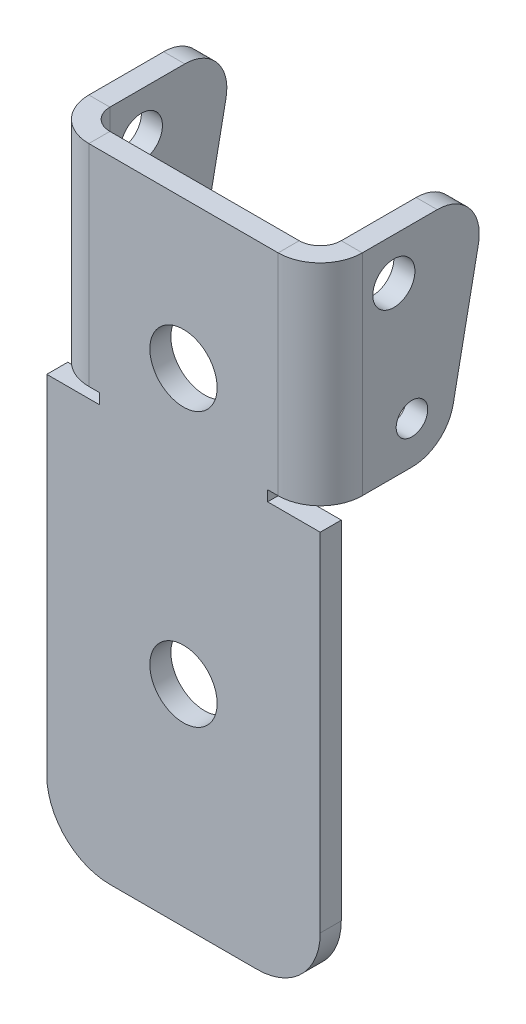
from build123d import *

# Parameters (mm, degrees)
SKETCH_1_W                        = 13
SKETCH_1_H                        = 30
SM_BASE_FLANGE_1_DEPTH            = 1
SM_EDGE_FLANGE_1_STRIP_W          = 6
SM_EDGE_FLANGE_1_STRIP_H          = 1
SM_EDGE_FLANGE_1_STRIP_CUT_DEPTH  = 10
SM_EDGE_FLANGE_1_RELIEF_W         = 6.5
SM_EDGE_FLANGE_1_RELIEF_H         = 0.5
SM_EDGE_FLANGE_1_RELIEF_CUT_DEPTH = 1
SM_EDGE_FLANGE_1_DEPTH            = 10
SM_EDGE_FLANGE_1_PROFILE_R        = 1
SM_EDGE_FLANGE_1_PROFILE_R_2      = 0.75
SM_EDGE_FLANGE_1_FLAT_DEPTH       = 1
FILLET_1_R                        = 3
SKETCH_9_R                        = 1.6
CUT_EXTRUDE_1_DEPTH               = 18.615014781


# Sheet-metal steps are written as plain solids
with BuildPart() as part:
    # Sketch 1 → 基体-法兰1 (new body)
    with BuildSketch(Plane.XY):
        Rectangle(SKETCH_1_W, SKETCH_1_H)
    extrude(amount=-SM_BASE_FLANGE_1_DEPTH)

    # 边线-法兰1 strip (across the edge) → 边线-法兰1 strip cut (cut)
    with BuildSketch(Plane(origin=(-6.5, 5, -1), x_dir=(1, 0, 0), z_dir=(0, 1, 0))):
        with Locations((-1, -0.5)):
            Rectangle(SM_EDGE_FLANGE_1_STRIP_W, SM_EDGE_FLANGE_1_STRIP_H)
    sm_edge_flange_1_strip_cut = extrude(amount=SM_EDGE_FLANGE_1_STRIP_CUT_DEPTH, mode=Mode.SUBTRACT)

    # 边线-法兰1 relief (on the sheet) → 边线-法兰1 relief cut (cut)
    with BuildSketch(Plane(origin=(-4.5, 5, -1), x_dir=(1, 0, 0), z_dir=(0, 0, -1))):
        with Locations((-2.75, 0.25)):
            Rectangle(SM_EDGE_FLANGE_1_RELIEF_W, SM_EDGE_FLANGE_1_RELIEF_H)
    sm_edge_flange_1_relief_cut = extrude(amount=-SM_EDGE_FLANGE_1_RELIEF_CUT_DEPTH, mode=Mode.SUBTRACT)

    # 边线-法兰1 bend section (across the edge) → 边线-法兰1 (add)
    with BuildSketch(Plane(origin=(-6.5, 5, -1), x_dir=(1, 0, 0), z_dir=(0, 1, 0))):
        with BuildLine():
            Line((0, 1), (1, 1))
            ThreePointArc((1, 1), (1.292893219, 0.292893219), (2, 0))
            Line((2, 0), (2, -1))
            ThreePointArc((2, -1), (0.585786438, -0.414213562), (0, 1))
        make_face()
    sm_edge_flange_1 = extrude(amount=SM_EDGE_FLANGE_1_DEPTH)

    # 边线-法兰1 profile (on flange) → 边线-法兰1 flat (add)
    with BuildSketch(Plane(origin=(-6.5, 0, -1), x_dir=(0, -1, 0), z_dir=(1, 0, 0))):
        with BuildLine():
            Line((-15, 1), (-5, 1))
            Line((-5, 1), (-5, 3.360392195))
            ThreePointArc((-5, 3.360392195), (-5.453315717, 4.628370006), (-6.60776773, 5.321553546))
            Line((-6.60776773, 5.321553546), (-12.60776773, 6.521553546))
            ThreePointArc((-12.60776773, 6.521553546), (-14.267977811, 6.107076477), (-15, 4.560392195))
            Line((-15, 4.560392195), (-15, 1))
        make_face()
        with Locations((-13, 2.5)):
            Circle(SM_EDGE_FLANGE_1_PROFILE_R, mode=Mode.SUBTRACT)
        with Locations((-7, 3.360392195)):
            Circle(SM_EDGE_FLANGE_1_PROFILE_R_2, mode=Mode.SUBTRACT)
    sm_edge_flange_1_flat = extrude(amount=SM_EDGE_FLANGE_1_FLAT_DEPTH)

    # 镜向1: 边线-法兰1 strip cut, 边线-法兰1 relief cut, 边线-法兰1, 边线-法兰1 flat across plane
    add(sm_edge_flange_1_strip_cut.mirror(Plane(origin=(0, 0, 0), x_dir=(0, 0, 1), z_dir=(1, 0, 0))), mode=Mode.SUBTRACT)
    add(sm_edge_flange_1_relief_cut.mirror(Plane(origin=(0, 0, 0), x_dir=(0, 0, 1), z_dir=(1, 0, 0))), mode=Mode.SUBTRACT)
    add(sm_edge_flange_1.mirror(Plane(origin=(0, 0, 0), x_dir=(0, 0, 1), z_dir=(1, 0, 0))))
    add(sm_edge_flange_1_flat.mirror(Plane(origin=(0, 0, 0), x_dir=(0, 0, 1), z_dir=(1, 0, 0))))

    # 圆角1
    fillet_1_edges = [part.edges().sort_by_distance(p)[0] for p in [
        (6.5, -15, -0.5),
        (-6.5, -15, -0.5),
    ]]
    fillet(fillet_1_edges, radius=FILLET_1_R)

    # 草图9 → 切除-拉伸1 (cut, through all)
    with BuildSketch(Plane(origin=(0, 0, -1), x_dir=(-1, 0, 0), z_dir=(0, 0, -1))):
        with Locations((0, 8)):
            Circle(SKETCH_9_R)
        with Locations((0, -5)):
            Circle(SKETCH_9_R)
    extrude(amount=-CUT_EXTRUDE_1_DEPTH, mode=Mode.SUBTRACT)


solid = part.part
